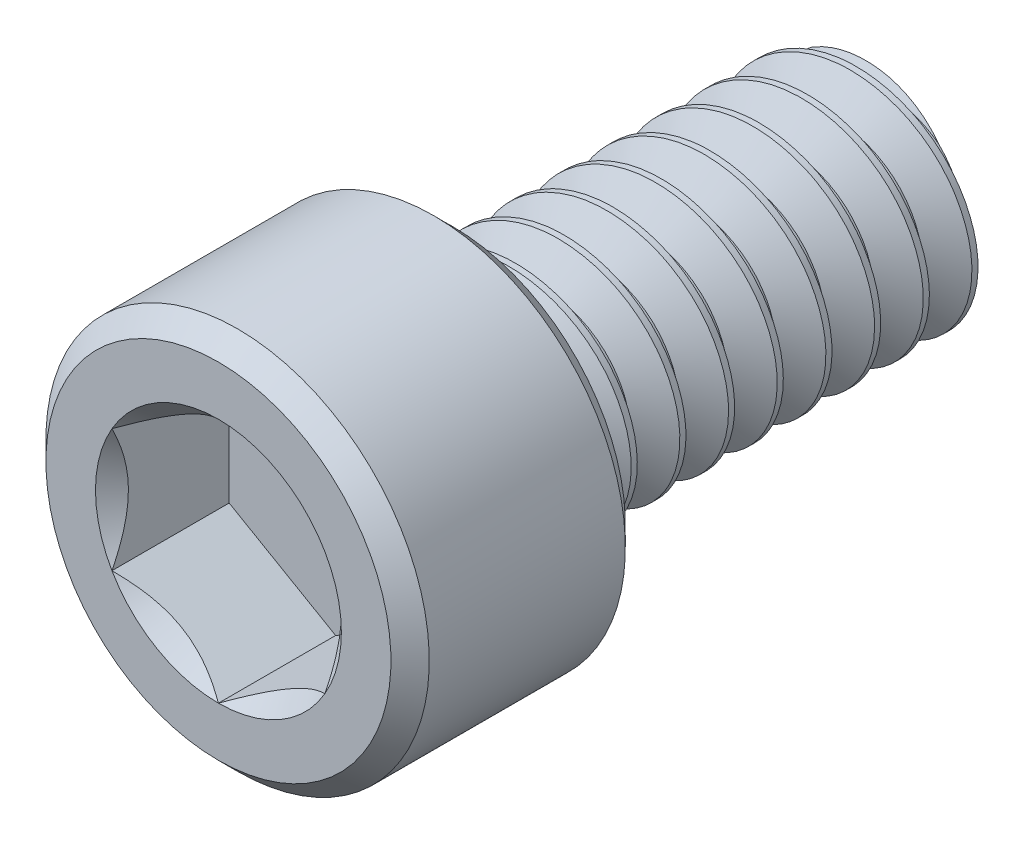
from build123d import *

# Parameters (mm, degrees)
CUT_EXTRUDE1_DEPTH = 1.0922
SKETCH4_R          = 1.14567944
CUT_EXTRUDE2_DEPTH = 1.0922
CUT_EXTRUDE2_TAPER = 45
CUT_SWEEP1_PITCH   = 0.453571429


# Read off the part's stored shape, not the designer's step: Split1
with BuildPart() as part:
    # Sketch2 → Revolve1 (revolve)
    with BuildSketch(Plane(origin=(0, 0, 0), x_dir=(0, 0, -1), z_dir=(1, 0, 0)), mode=Mode.PRIVATE) as revolve1_sk:
        Polygon((3.96875, 0.98298), (3.85953, 1.0922), (0, 1.0922), (0, 1.60734375), (-0.17859375, 1.7859375), (-2.00580625, 1.7859375), (-2.1844, 1.60734375), (-2.1844, 0.9921875), (-1.0922, 0.9921875), (-1.0922, 0), (3.96875, 0), align=None)
    revolve(revolve1_sk.sketch.rotate(Axis((0, 0, 1.0922), (0, 0, -1)), 180), axis=Axis((0, 0, 1.0922), (0, 0, -1)))

    # Sketch3 → Cut-Extrude1 (cut)
    with BuildSketch(Plane.XY.offset(2.1844)):
        Polygon((0, 1.14567944), (-0.9921875, 0.57283972), (-0.9921875, -0.57283972), (0, -1.14567944), (0.9921875, -0.57283972), (0.9921875, 0.57283972), align=None)
    extrude(amount=-CUT_EXTRUDE1_DEPTH, mode=Mode.SUBTRACT)

    # Sketch4 → Cut-Extrude2 (cut)
    with BuildSketch(Plane.XY.offset(2.1844)):
        Circle(SKETCH4_R)
    extrude(amount=-CUT_EXTRUDE2_DEPTH, taper=CUT_EXTRUDE2_TAPER, mode=Mode.SUBTRACT)


with BuildPart() as body_2:
    # Split1: the piece on the far side of the plane
    add(part.part)
    split(bisect_by=Plane.XY, keep=Keep.BOTTOM)

    # Cut-Sweep1: the profile of Sketch7 screwed along a right-hand helix of 9.75 turns, 6 arcs to a turn; built about Z, then put on its axis
    cut_sweep1_z = Axis((0, 0, 0), (0, 0, 1))
    cut_sweep1_corners = [(1.116750274, 0, -0.411049107), (1.141300547, 0, 0.028348214), (0.797596715, 0, -0.170089286), (0.797596715, 0, -0.226785714)]
    with BuildLine(mode=Mode.PRIVATE) as cut_sweep1_profile:
        Line(cut_sweep1_corners[0], cut_sweep1_corners[1])
        Line(cut_sweep1_corners[1], cut_sweep1_corners[2])
        Line(cut_sweep1_corners[2], cut_sweep1_corners[3])
        Line(cut_sweep1_corners[3], cut_sweep1_corners[0])
    cut_sweep1_cap = Face(cut_sweep1_profile.wire())
    cut_sweep1_turn_angles = [0, 30, 60, 90, 120, 150, 180, 210, 240, 270, 300, 330, 360]
    cut_sweep1_turn_weights = [1, 0.8660254037844387, 1, 0.8660254037844387, 1, 0.8660254037844387, 1, 0.8660254037844387, 1, 0.8660254037844387, 1, 0.8660254037844387, 1]
    cut_sweep1_turn_rails = [Edge.make_bspline([Vector(p[0], p[1], 0).rotate(cut_sweep1_z, cut_sweep1_turn_angles[k]) / cut_sweep1_turn_weights[k] + Vector(0, 0, p[2] + CUT_SWEEP1_PITCH * cut_sweep1_turn_angles[k] / 360) for k in range(13)], [0, 0, 0, 1, 1, 2, 2, 3, 3, 4, 4, 5, 5, 6, 6, 6], 2, cut_sweep1_turn_weights) for p in cut_sweep1_corners]
    cut_sweep1_turn_sides = [Face.make_surface_from_curves(cut_sweep1_turn_rails[p[0]], cut_sweep1_turn_rails[p[1]]) for p in [(0, 1), (1, 2), (2, 3), (3, 0)]]
    cut_sweep1_last_angles = [3240, 3270, 3300, 3330, 3360, 3390, 3420, 3450, 3480, 3495, 3510]
    cut_sweep1_last_weights = [1, 0.8660254037844387, 1, 0.8660254037844387, 1, 0.8660254037844387, 1, 0.8660254037844387, 1, 0.9659258262890683, 1]
    cut_sweep1_last_rails = [Edge.make_bspline([Vector(p[0], p[1], 0).rotate(cut_sweep1_z, cut_sweep1_last_angles[k]) / cut_sweep1_last_weights[k] + Vector(0, 0, p[2] + CUT_SWEEP1_PITCH * cut_sweep1_last_angles[k] / 360) for k in range(11)], [0, 0, 0, 1, 1, 2, 2, 3, 3, 4, 4, 5, 5, 5], 2, cut_sweep1_last_weights) for p in cut_sweep1_corners]
    cut_sweep1_last_sides = [Face.make_surface_from_curves(cut_sweep1_last_rails[p[0]], cut_sweep1_last_rails[p[1]]) for p in [(0, 1), (1, 2), (2, 3), (3, 0)]]
    cut_sweep1 = Plane(origin=(0, 0, 0), x_dir=(0, 1, 0), z_dir=(0, 0, -1)) * Solid(Shell([*[p.moved(Location((0, 0, CUT_SWEEP1_PITCH * i))) for i in range(9) for p in cut_sweep1_turn_sides], *cut_sweep1_last_sides, cut_sweep1_cap, cut_sweep1_cap.rotate(cut_sweep1_z, 3510).moved(Location((0, 0, CUT_SWEEP1_PITCH * 3510 / 360)))]))
    add(cut_sweep1, mode=Mode.SUBTRACT)


with BuildPart() as part_1:
    add(part.part)

    # Split1
    split(bisect_by=Plane.XY, keep=Keep.TOP)

    # Combine1: union body 2
    add(body_2.part)


solid = part_1.part
